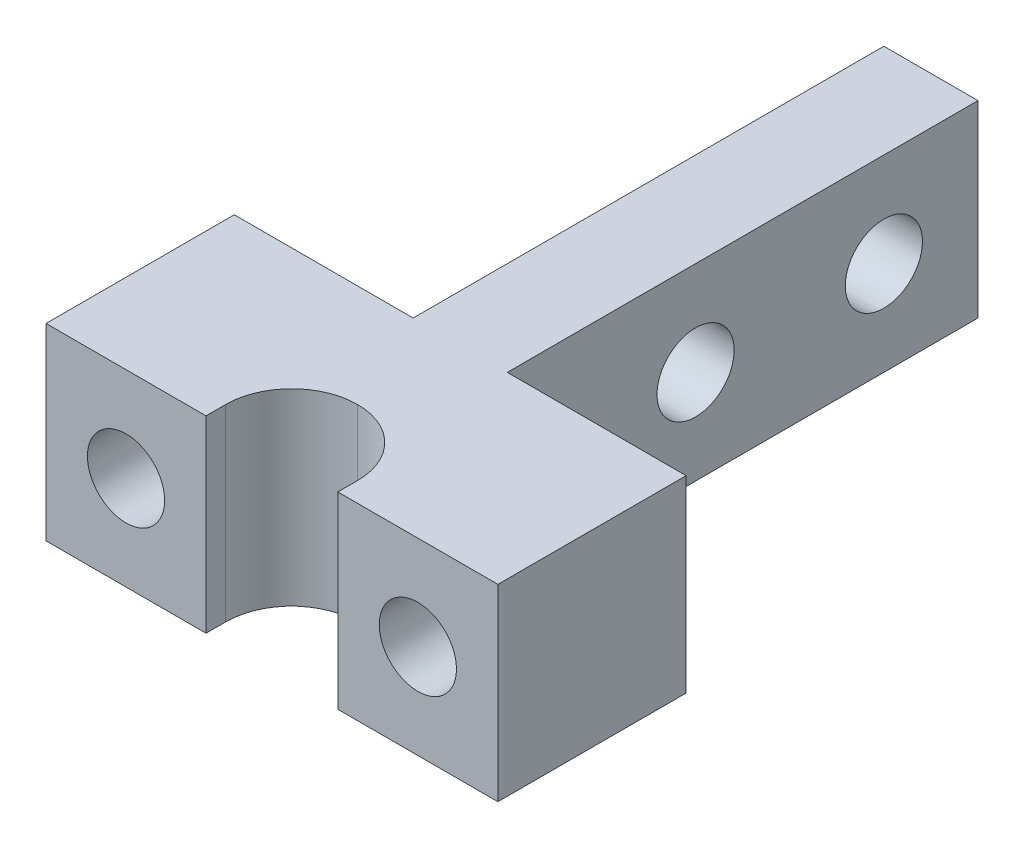
from build123d import *

# Parameters (mm, degrees)
BOSS_EXTRUDE1_DEPTH = 20
SKETCH3_R           = 4.1
CUT_EXTRUDE1_DEPTH  = 77.978565174
SKETCH4_R           = 4.1
CUT_EXTRUDE2_DEPTH  = 69.374877828
FILLET1_R           = 7


with BuildPart() as part:
    # Sketch1 → Boss-Extrude1 (new body)
    with BuildSketch(Plane(origin=(0, 0, 0), x_dir=(1, 0, 0), z_dir=(0, 1, 0))):
        Polygon((-22.986013986, 8.601398601), (-22.986013986, -11.398601399), (-5.986013986, -11.398601399), (-5.986013986, -2.307692308), (8.013986014, -2.307692308), (8.013986014, -11.398601399), (25.013986014, -11.398601399), (25.013986014, 8.601398601), (6.013986014, 8.601398601), (6.013986014, 58.601398601), (-3.986013986, 58.601398601), (-3.986013986, 8.601398601), align=None)
    extrude(amount=BOSS_EXTRUDE1_DEPTH)

    # Sketch3 → Cut-Extrude1 (cut, through all)
    with BuildSketch(Plane.XY.offset(11.398601399)):
        with Locations((-14.486013986, 10)):
            Circle(SKETCH3_R)
        with Locations((16.513986014, 10)):
            Circle(SKETCH3_R)
    extrude(amount=-CUT_EXTRUDE1_DEPTH, mode=Mode.SUBTRACT)

    # Sketch4 → Cut-Extrude2 (cut, through all)
    with BuildSketch(Plane(origin=(6.013986014, 0, 0), x_dir=(0, 0, -1), z_dir=(1, 0, 0))):
        with Locations((28.601398601, 10)):
            Circle(SKETCH4_R)
        with Locations((48.601398601, 10)):
            Circle(SKETCH4_R)
    extrude(amount=-CUT_EXTRUDE2_DEPTH, mode=Mode.SUBTRACT)

    # Fillet1
    fillet1_edges = [part.edges().sort_by_distance(p)[0] for p in [
        (-5.986013986, 10, 2.307692308),
        (8.013986014, 10, 2.307692308),
    ]]
    fillet(fillet1_edges, radius=FILLET1_R - 0.0001)  # a hair under: the kernel refuses the full size


solid = part.part
